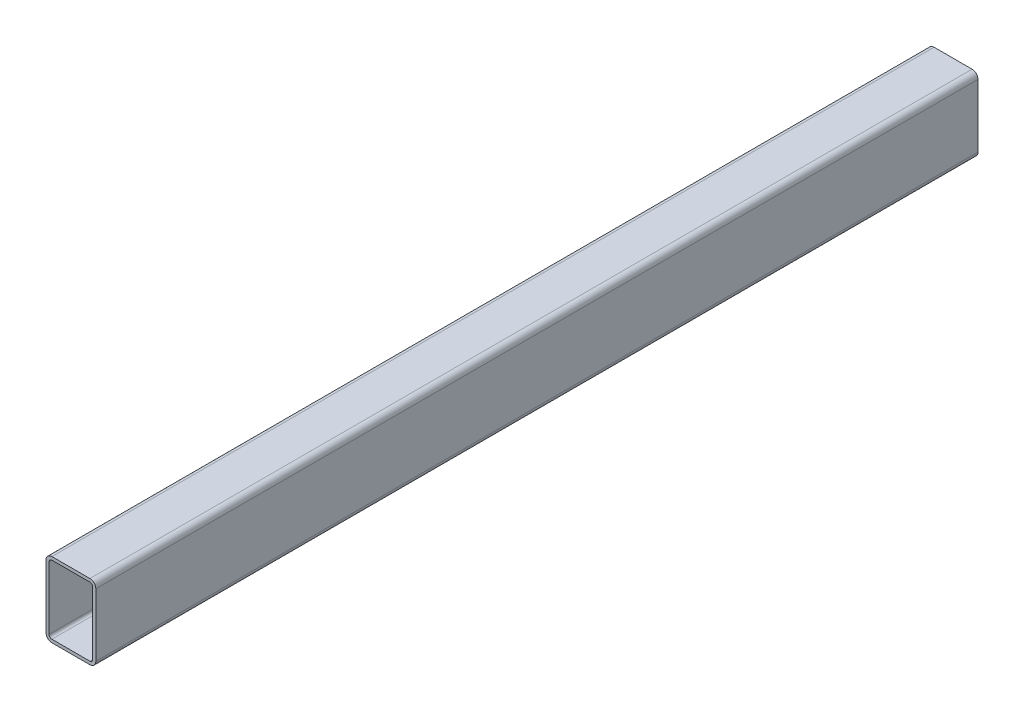
from build123d import *

# Parameters (mm, degrees)
BOSS_EXTRUDE1_DEPTH = 450


with BuildPart() as part:
    # Sketch1 → Boss-Extrude1 (new, symmetric)
    with BuildSketch(Plane.XY):
        with BuildLine():
            Line((19.4, -38.1), (-19.4, -38.1))
            ThreePointArc((-19.4, -38.1), (-23.642640687, -36.342640687), (-25.4, -32.1))
            Line((-25.4, -32.1), (-25.4, 32.1))
            ThreePointArc((-25.4, 32.1), (-23.642640687, 36.342640687), (-19.4, 38.1))
            Line((-19.4, 38.1), (19.4, 38.1))
            ThreePointArc((19.4, 38.1), (23.642640687, 36.342640687), (25.4, 32.1))
            Line((25.4, 32.1), (25.4, -32.1))
            ThreePointArc((25.4, -32.1), (23.642640687, -36.342640687), (19.4, -38.1))
        make_face()
        with BuildLine():
            Line((19.4, 34.925), (-19.4, 34.925))
            ThreePointArc((-19.4, 34.925), (-21.397576657, 34.097576657), (-22.225, 32.1))
            Line((-22.225, 32.1), (-22.225, -32.1))
            ThreePointArc((-22.225, -32.1), (-21.397576657, -34.097576657), (-19.4, -34.925))
            Line((-19.4, -34.925), (19.4, -34.925))
            ThreePointArc((19.4, -34.925), (21.397576657, -34.097576657), (22.225, -32.1))
            Line((22.225, -32.1), (22.225, 32.1))
            ThreePointArc((22.225, 32.1), (21.397576657, 34.097576657), (19.4, 34.925))
        make_face(mode=Mode.SUBTRACT)
    extrude(amount=BOSS_EXTRUDE1_DEPTH, both=True)


solid = part.part
